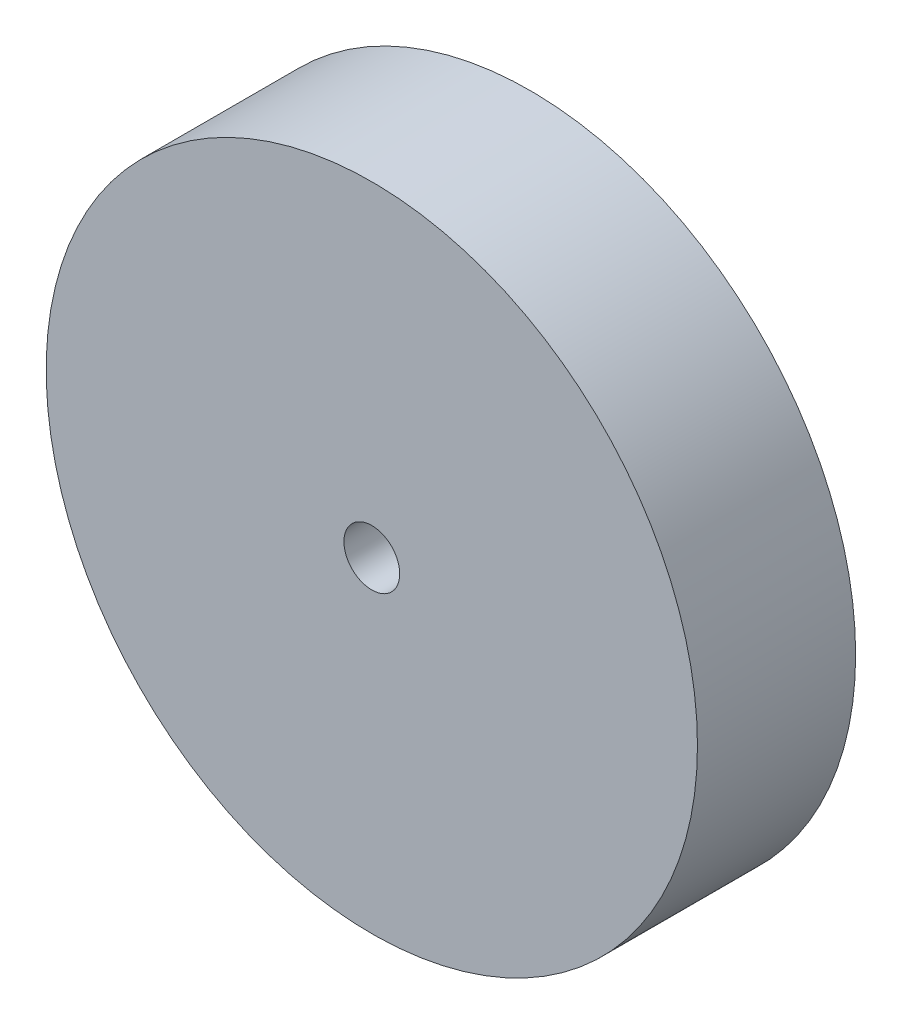
from build123d import *

# Parameters (mm, degrees)
SKETCH1_R           = 18
BOSS_EXTRUDE1_DEPTH = 20
SKETCH2_R           = 3
CUT_EXTRUDE1_DEPTH  = 60
SKETCH4_R           = 35
SKETCH4_R_2         = 14.576002813
BOSS_EXTRUDE2_DEPTH = 17


with BuildPart() as part:
    # Sketch1 → Boss-Extrude1 (new body)
    with BuildSketch(Plane.XY):
        Circle(SKETCH1_R)
    extrude(amount=BOSS_EXTRUDE1_DEPTH)

    # Sketch2 → Cut-Extrude1 (cut)
    with BuildSketch(Plane.XY.offset(20)):
        Circle(SKETCH2_R)
    extrude(amount=-CUT_EXTRUDE1_DEPTH, mode=Mode.SUBTRACT)

    # Sketch4 → Boss-Extrude2 (add)
    with BuildSketch(Plane.XY.offset(20)):
        Circle(SKETCH4_R)
        Circle(SKETCH4_R_2, mode=Mode.SUBTRACT)
    extrude(amount=-BOSS_EXTRUDE2_DEPTH)


solid = part.part
